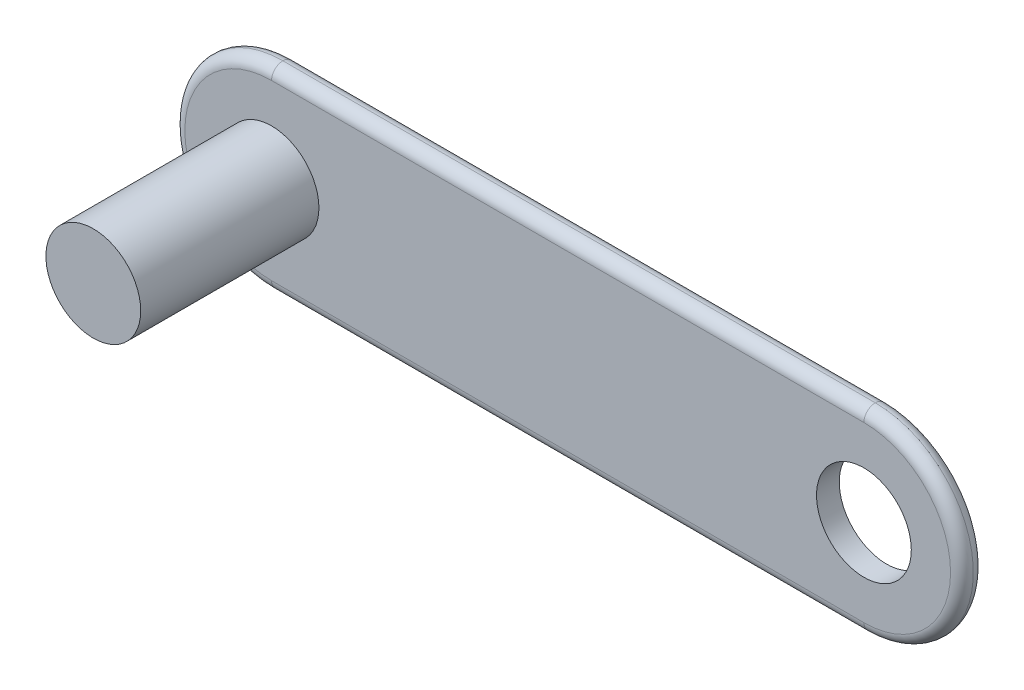
from build123d import *

# Parameters (mm, degrees)
BOSS_EXTRUDE1_DEPTH     = 1.524
FILLET1_R               = 1.524
SKETCH3_R               = 6.35
BOSS_EXTRUDE3_DEPTH     = 25.4
CUT_EXTRUDE4_DEPTH      = 97.813899613
CUT_EXTRUDE4_DEPTH_BACK = 97.813899613
SKETCH5_R               = 6.35


with BuildPart() as part:
    # Sketch2 → Boss-Extrude1 (new, symmetric)
    with BuildSketch(Plane.XY):
        with BuildLine():
            Line((0, 13.135315222), (79.359196135, 13.135315222))
            ThreePointArc((79.359196135, 13.135315222), (92.494511357, 0), (79.359196135, -13.135315222))
            Line((79.359196135, -13.135315222), (0, -13.135315222))
            ThreePointArc((0, -13.135315222), (-13.135315222, 0), (0, 13.135315222))
        make_face()
    extrude(amount=BOSS_EXTRUDE1_DEPTH, both=True)

    # Fillet1
    fillet1_edges = [part.edges().sort_by_distance(p)[0] for p in [
        (92.494511357, 0, -1.524),
        (39.679598067, -13.135315222, -1.524),
        (-13.135315222, 0, -1.524),
        (92.494511357, 0, 1.524),
        (39.679598067, -13.135315222, 1.524),
        (-13.135315222, 0, 1.524),
        (39.679598067, 13.135315222, -1.524),
        (39.679598067, 13.135315222, 1.524),
    ]]
    fillet(fillet1_edges, radius=FILLET1_R - 0.0001)  # a hair under: the kernel refuses the full size

    # Sketch3 → Boss-Extrude3 (add)
    with BuildSketch(Plane.XY):
        Circle(SKETCH3_R)
    extrude(amount=BOSS_EXTRUDE3_DEPTH)

    # Sketch5 → Cut-Extrude4 (cut, two sides: drawn at the far end of the back side and taken through both)
    with BuildSketch(Plane.XY.offset(-CUT_EXTRUDE4_DEPTH_BACK)):
        with Locations((79.359196135, 0)):
            Circle(SKETCH5_R)
    extrude(amount=CUT_EXTRUDE4_DEPTH + CUT_EXTRUDE4_DEPTH_BACK, mode=Mode.SUBTRACT)


solid = part.part
